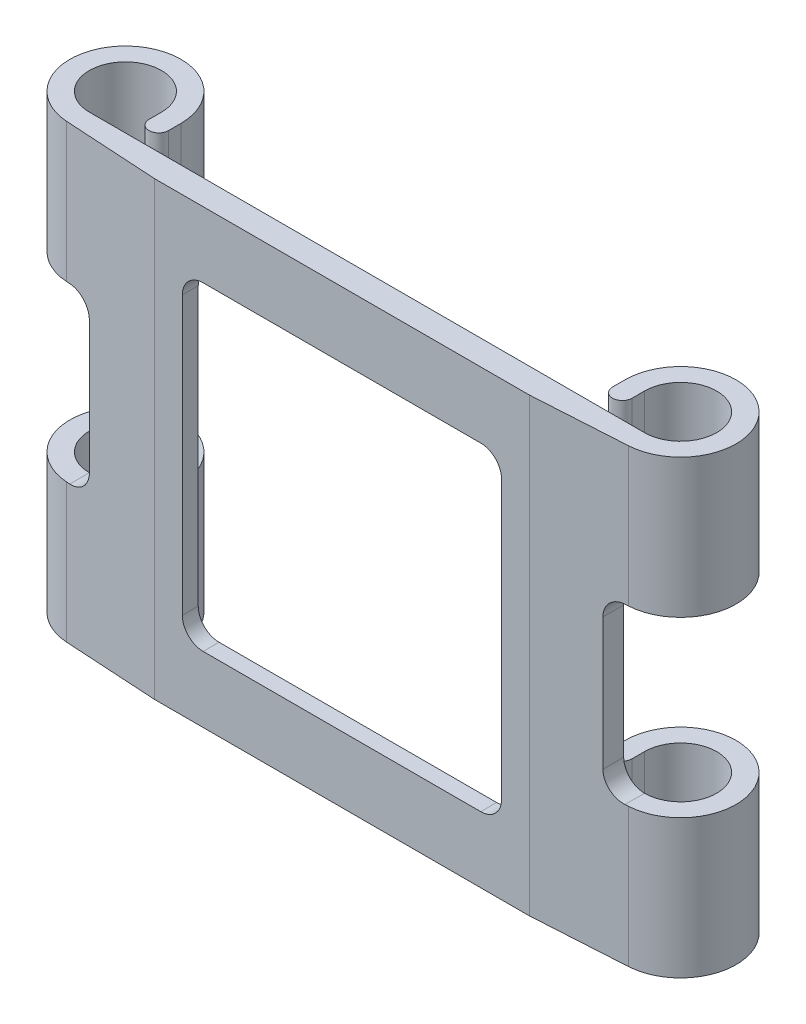
from build123d import *

# Parameters (mm, degrees)
BOSS_EXTRUDE1_DEPTH     = 65
CUT_EXTRUDE4_DEPTH      = 83.530236883
CUT_EXTRUDE4_DEPTH_BACK = 83.530236883
SKETCH4_W               = 13.2
SKETCH4_H               = 25
CUT_EXTRUDE5_DEPTH      = 82.873316777
SKETCH2_W               = 50.29
SKETCH2_H               = 50.29
CUT_EXTRUDE1_DEPTH      = 1.31
SKETCH3_W               = 46
SKETCH3_H               = 46
CUT_EXTRUDE2_DEPTH      = 83.094702022
FILLET1_R               = 3


with BuildPart() as part:
    # Sketch1 → Boss-Extrude1 (new body)
    with BuildSketch(Plane(origin=(0, 0, 0), x_dir=(1, 0, 0), z_dir=(0, 1, 0))):
        with BuildLine():
            Line((40, 3.6), (-40, 3.6))
            ThreePointArc((-40, 3.6), (-43.676955262, 12.476955262), (-34.8, 8.8))
            Line((-34.8, 8.8), (-34.8, 7))
            ThreePointArc((-34.8, 7), (-33.4, 5.6), (-32, 7))
            Line((-32, 7), (-32, 8.8))
            ThreePointArc((-32, 8.8), (-45.48362974, 14.624929603), (-40.482451219, 0.8145607))
            Line((-40.482451219, 0.8145607), (-27, 0))
            Line((-27, 0), (27, 0))
            Line((27, 0), (40.482451219, 0.8145607))
            ThreePointArc((40.482451219, 0.8145607), (45.48362974, 14.624929603), (32, 8.8))
            Line((32, 8.8), (32, 7))
            ThreePointArc((32, 7), (33.4, 5.6), (34.8, 7))
            Line((34.8, 7), (34.8, 8.8))
            ThreePointArc((34.8, 8.8), (43.676955262, 12.476955262), (40, 3.6))
        make_face()
    extrude(amount=BOSS_EXTRUDE1_DEPTH)

    # Sketch4 → Cut-Extrude4 (cut, two sides: drawn at the far end of the back side and taken through both)
    with BuildSketch(Plane(origin=(0, 0, 0), x_dir=(0, 0, -1), z_dir=(1, 0, 0)).offset(-CUT_EXTRUDE4_DEPTH_BACK)):
        with Locations((10.2, 32.5)):
            Rectangle(SKETCH4_W, SKETCH4_H)
    extrude(amount=CUT_EXTRUDE4_DEPTH + CUT_EXTRUDE4_DEPTH_BACK, mode=Mode.SUBTRACT)

    # Sketch5 → Cut-Extrude5 (cut, through all)
    with BuildSketch(Plane(origin=(0, 0, -3.6), x_dir=(-1, 0, 0), z_dir=(0, 0, -1))):
        with BuildLine():
            Line((46.079473661, 45), (40, 45))
            ThreePointArc((40, 45), (37.878679656, 44.121320344), (37, 42))
            Line((37, 42), (37, 23))
            ThreePointArc((37, 23), (37.878679656, 20.878679656), (40, 20))
            Line((40, 20), (46.079473661, 20))
            Line((46.079473661, 20), (46.079473661, 45))
        make_face()
        with BuildLine():
            Line((-46.079473661, 20), (-40, 20))
            ThreePointArc((-40, 20), (-37.878679656, 20.878679656), (-37, 23))
            Line((-37, 23), (-37, 42))
            ThreePointArc((-37, 42), (-37.878679656, 44.121320344), (-40, 45))
            Line((-40, 45), (-46.079473661, 45))
            Line((-46.079473661, 45), (-46.079473661, 20))
        make_face()
    extrude(amount=-CUT_EXTRUDE5_DEPTH, mode=Mode.SUBTRACT)

    # Sketch2 → Cut-Extrude1 (cut)
    with BuildSketch(Plane(origin=(0, 0, -3.6), x_dir=(-1, 0, 0), z_dir=(0, 0, -1))):
        with Locations((0, 32.5)):
            Rectangle(SKETCH2_W, SKETCH2_H)
    extrude(amount=-CUT_EXTRUDE1_DEPTH, mode=Mode.SUBTRACT)

    # Sketch3 → Cut-Extrude2 (cut, through all)
    with BuildSketch(Plane(origin=(0, 0, -2.29), x_dir=(-1, 0, 0), z_dir=(0, 0, -1))):
        with Locations((0, 32.5)):
            Rectangle(SKETCH3_W, SKETCH3_H)
    extrude(amount=-CUT_EXTRUDE2_DEPTH, mode=Mode.SUBTRACT)

    # Fillet1
    fillet1_edges = [part.edges().sort_by_distance(p)[0] for p in [
        (-23, 55.5, -1.145),
        (23, 55.5, -1.145),
        (23, 9.5, -1.145),
        (-23, 9.5, -1.145),
    ]]
    fillet(fillet1_edges, radius=FILLET1_R)


solid = part.part
